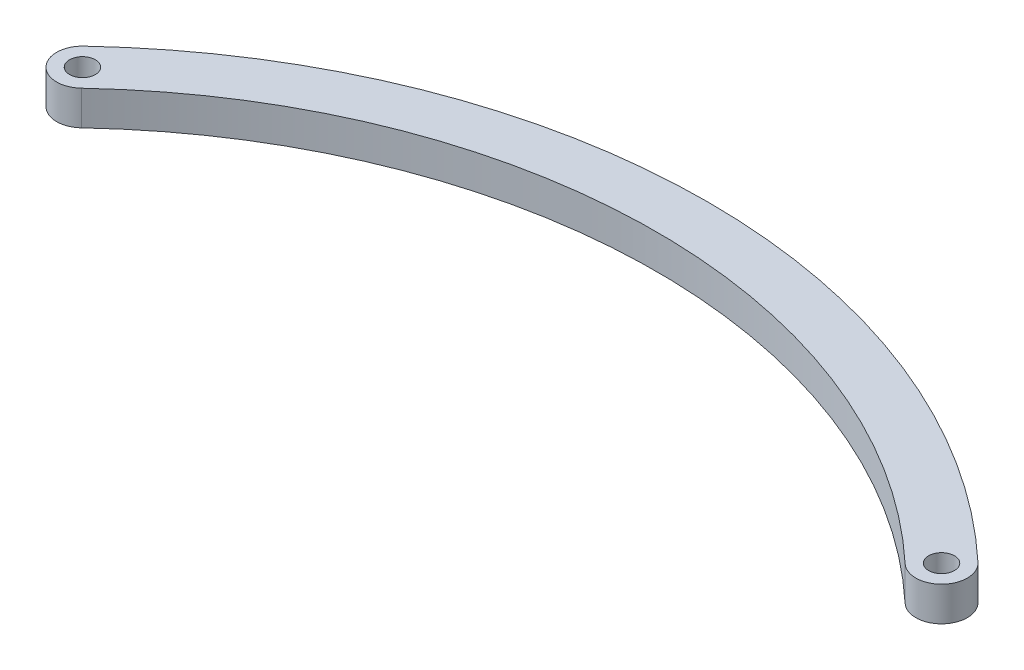
from build123d import *

# Parameters (mm, degrees)
ESQUISSE1_R        = 1.5
BOSS_EXTRU_1_DEPTH = 4


with BuildPart() as part:
    # Esquisse1 → Boss.-Extru.1 (new body)
    with BuildSketch(Plane(origin=(0, 0, 0), x_dir=(1, 0, 0), z_dir=(0, 1, 0))):
        with BuildLine():
            ThreePointArc((-52.054794536, 2.185822365), (-52.185822369, -2.054794533), (-47.945205471, -2.185822372))
            ThreePointArc((-47.945205471, -2.185822372), (-1.4e-08, 16.811655412), (47.94520545, -2.185822352))
            ThreePointArc((47.94520545, -2.185822352), (52.185822338, -2.054794566), (52.054794582, 2.185822323))
            ThreePointArc((52.054794582, 2.185822323), (3.1e-08, 22.811655412), (-52.054794536, 2.185822365))
        make_face()
        with Locations((-50, 0)):
            Circle(ESQUISSE1_R, mode=Mode.SUBTRACT)
        with Locations((50, 0)):
            Circle(ESQUISSE1_R, mode=Mode.SUBTRACT)
    extrude(amount=BOSS_EXTRU_1_DEPTH)


solid = part.part
